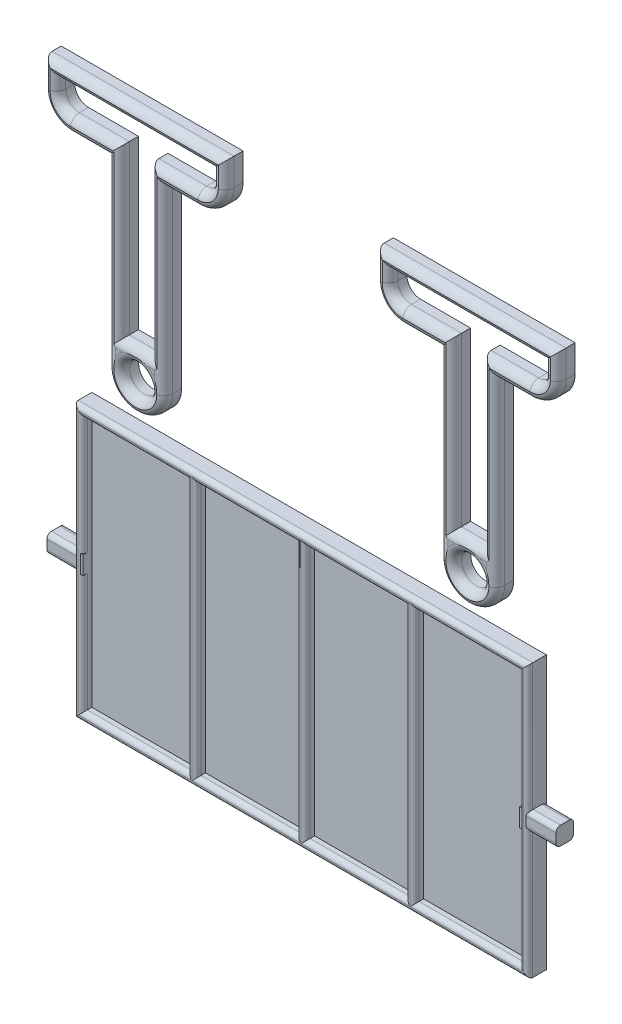
from build123d import *

# Parameters (mm, degrees)
CROQUIS1_W                   = 50
CROQUIS1_H                   = 30
SALIENTE_EXTRUIR1_DEPTH      = 1
CROQUIS2_W                   = 11.5
CROQUIS2_H                   = 28
CROQUIS2_W_2                 = 11
SALIENTE_EXTRUIR2_DEPTH      = 1
REDONDEO1_R                  = 0.5
SALIENTE_EXTRUIR3_DEPTH      = 0.95
SALIENTE_EXTRUIR3_DEPTH_BACK = 1
CROQUIS3_W                   = 4
CROQUIS3_H                   = 2
REDONDEO3_R                  = 0.5
CROQUIS4_R                   = 1.6
SALIENTE_EXTRUIR6_DEPTH      = 2
SALIENTE_EXTRUIR6_2_DEPTH    = 2
REDONDEO4_R                  = 1
REDONDEO5_R                  = 1


# Some blends are built 0.0001 mm under size
with BuildPart() as part:
    # Croquis1 → Saliente-Extruir1 (new body)
    with BuildSketch(Plane.XY):
        Rectangle(CROQUIS1_W, CROQUIS1_H)
    extrude(amount=SALIENTE_EXTRUIR1_DEPTH)

    # Croquis2 → Saliente-Extruir2 (add)
    with BuildSketch(Plane.XY.offset(1)):
        Polygon((-25, 15), (-24, 15), (24, 15), (25, 15), (25, -14), (25, -15), (-24, -15), (-25, -15), align=None)
        with Locations((-18.25, 0)):
            Rectangle(CROQUIS2_W, CROQUIS2_H, mode=Mode.SUBTRACT)
        with Locations((-6, 0)):
            Rectangle(CROQUIS2_W_2, CROQUIS2_H, mode=Mode.SUBTRACT)
        with Locations((18.25, 0)):
            Rectangle(CROQUIS2_W, CROQUIS2_H, mode=Mode.SUBTRACT)
        with Locations((6, 0)):
            Rectangle(CROQUIS2_W_2, CROQUIS2_H, mode=Mode.SUBTRACT)
    extrude(amount=SALIENTE_EXTRUIR2_DEPTH)

    # Redondeo1
    redondeo1_edges = [part.edges().sort_by_distance(p)[0] for p in [
        (-25, 0, 2),
        (0, -15, 2),
        (25, 0, 2),
        (0, 15, 2),
        (-18.25, -14, 2),
        (-12.5, 0, 2),
        (-18.25, 14, 2),
        (-24, 0, 2),
        (18.25, -14, 2),
        (24, 0, 2),
        (18.25, 14, 2),
        (12.5, 0, 2),
        (6, -14, 2),
        (11.5, 0, 2),
        (6, 14, 2),
        (0.5, 0, 2),
        (-6, -14, 2),
        (-0.5, 0, 2),
        (-6, 14, 2),
        (-11.5, 0, 2),
    ]]
    fillet(redondeo1_edges, radius=REDONDEO1_R - 0.0001)  # a hair under: the kernel refuses the full size

    # Croquis3 → Saliente-Extruir3 (add, two sides: drawn at the far end of the back side and taken through both)
    with BuildSketch(Plane.XY.offset(1).offset(-SALIENTE_EXTRUIR3_DEPTH_BACK)):
        with Locations((-26, 0)):
            Rectangle(CROQUIS3_W, CROQUIS3_H)
        with Locations((26, 0)):
            Rectangle(CROQUIS3_W, CROQUIS3_H)
    extrude(amount=SALIENTE_EXTRUIR3_DEPTH + SALIENTE_EXTRUIR3_DEPTH_BACK)

    # Redondeo3
    redondeo3_edges = [part.edges().sort_by_distance(p)[0] for p in [
        (-26.5, -1, 0),
        (-26.5, 1, 0),
        (-26.359011002, -1, 1.95),
        (-26.359011002, 1, 1.95),
        (26.5, -1, 0),
        (26.5, 1, 0),
        (26.359011002, -1, 1.95),
        (26.359011002, 1, 1.95),
    ]]
    fillet(redondeo3_edges, radius=REDONDEO3_R)


with BuildPart() as body_2:
    # Croquis4 → Saliente-Extruir6 (new body)
    with BuildSketch(Plane.XY):
        with BuildLine():
            Line((15.163338431, 40.314929212), (11.163338431, 40.314929212))
            ThreePointArc((11.163338431, 40.314929212), (9.042018087, 41.193608868), (8.163338431, 43.314929212))
            Line((8.163338431, 43.314929212), (8.163338431, 46.314929212))
            Line((8.163338431, 46.314929212), (28.163338431, 46.314929212))
            Line((28.163338431, 46.314929212), (28.163338431, 43.314929212))
            ThreePointArc((28.163338431, 43.314929212), (27.284658775, 41.193608868), (25.163338431, 40.314929212))
            Line((25.163338431, 40.314929212), (21.410533823, 40.314929212))
            Line((21.410533823, 40.314929212), (21.410533823, 20.314929212))
            ThreePointArc((21.410533823, 20.314929212), (18.286936127, 17.191331515), (15.163338431, 20.314929212))
            Line((15.163338431, 20.314929212), (15.163338431, 40.314929212))
        make_face()
        with Locations((18.286936127, 20.314929212)):
            Circle(CROQUIS4_R, mode=Mode.SUBTRACT)
        with BuildLine():
            Line((16.663338431, 41.965138463), (11.163338431, 41.965138463))
            ThreePointArc((11.163338431, 41.965138463), (10.102678259, 42.404478291), (9.663338431, 43.465138463))
            Line((9.663338431, 43.465138463), (9.663338431, 44.814929212))
            Line((9.663338431, 44.814929212), (26.663338431, 44.814929212))
            Line((26.663338431, 44.814929212), (26.663338431, 43.465138463))
            ThreePointArc((26.663338431, 43.465138463), (26.223998603, 42.404478291), (25.163338431, 41.965138463))
            Line((25.163338431, 41.965138463), (19.910533823, 41.965138463))
            Line((19.910533823, 41.965138463), (19.910533823, 23.544908309))
            Line((19.910533823, 23.544908309), (16.663338431, 23.544908309))
            Line((16.663338431, 23.544908309), (16.663338431, 41.965138463))
        make_face(mode=Mode.SUBTRACT)
    extrude(amount=SALIENTE_EXTRUIR6_DEPTH)

    # Redondeo4
    # the kernel refuses this fillet: 1 mm, written as the material it takes off along each edge
    with BuildSketch(Plane(origin=(25.163338431, 40.314929212, 2), x_dir=(0, 0, -1), z_dir=(-1, 0, 0))) as redondeo4_piece_1:
        with BuildLine():
            CenterArc((REDONDEO4_R, -REDONDEO4_R), REDONDEO4_R, 90, 90)
            Line((0, -REDONDEO4_R), (0, 0))
            Line((0, 0), (REDONDEO4_R, 0))
        make_face()
    extrude(amount=3.752804608, mode=Mode.SUBTRACT)
    with BuildSketch(Plane(origin=(25.163338431, 43.314929212, 2), x_dir=(1, 0, 0), z_dir=(0, 1, 0))) as redondeo4_piece_2:
        with BuildLine():
            CenterArc((3 - REDONDEO4_R, REDONDEO4_R), REDONDEO4_R, 270, 90)
            Line((3 - REDONDEO4_R, 0), (3, 0))
            Line((3, 0), (3, REDONDEO4_R))
        make_face()
    revolve(axis=Axis((25.163338431, 43.314929212, 2), (0, 0, -1)), revolution_arc=90, mode=Mode.SUBTRACT)
    with BuildSketch(Plane(origin=(28.163338431, 48.814929212, 2), x_dir=(0, 0, -1), z_dir=(0, -1, 0)), Plane(origin=(8.163338431, 43.314929212, 2), x_dir=(0, 0, -1), z_dir=(0, 1, 0))) as redondeo4_piece_3:
        with BuildLine():
            CenterArc((REDONDEO4_R, -REDONDEO4_R), REDONDEO4_R, 90, 90)
            Line((0, -REDONDEO4_R), (0, 0))
            Line((0, 0), (REDONDEO4_R, 0))
        make_face()
    extrude(amount=5.5, mode=Mode.SUBTRACT)
    with BuildSketch(Plane(origin=(5.663338431, 46.314929212, 2), x_dir=(0, 0, -1), z_dir=(1, 0, 0))) as redondeo4_piece_4:
        with BuildLine():
            CenterArc((REDONDEO4_R, -REDONDEO4_R), REDONDEO4_R, 90, 90)
            Line((0, -REDONDEO4_R), (0, 0))
            Line((0, 0), (REDONDEO4_R, 0))
        make_face()
    extrude(amount=25, mode=Mode.SUBTRACT)
    with BuildSketch(Plane(origin=(11.163338431, 43.314929212, 2), x_dir=(0, -1, 0), z_dir=(1, 0, 0))) as redondeo4_piece_5:
        with BuildLine():
            CenterArc((3 - REDONDEO4_R, REDONDEO4_R), REDONDEO4_R, 270, 90)
            Line((3 - REDONDEO4_R, 0), (3, 0))
            Line((3, 0), (3, REDONDEO4_R))
        make_face()
    revolve(axis=Axis((11.163338431, 43.314929212, 2), (0, 0, -1)), revolution_arc=90, mode=Mode.SUBTRACT)
    with BuildSketch(Plane(origin=(15.163338431, 40.314929212, 2), x_dir=(0, 0, -1), z_dir=(-1, 0, 0))) as redondeo4_piece_6:
        with BuildLine():
            CenterArc((REDONDEO4_R, -REDONDEO4_R), REDONDEO4_R, 90, 90)
            Line((0, -REDONDEO4_R), (0, 0))
            Line((0, 0), (REDONDEO4_R, 0))
        make_face()
    extrude(amount=4, mode=Mode.SUBTRACT)
    with BuildSketch(Plane(origin=(15.163338431, 20.314929212, 2), x_dir=(0, 0, -1), z_dir=(0, 1, 0)), Plane(origin=(21.410533823, 40.314929212, 2), x_dir=(0, 0, -1), z_dir=(0, -1, 0))) as redondeo4_piece_7:
        with BuildLine():
            CenterArc((REDONDEO4_R, -REDONDEO4_R), REDONDEO4_R, 90, 90)
            Line((0, -REDONDEO4_R), (0, 0))
            Line((0, 0), (REDONDEO4_R, 0))
        make_face()
    extrude(amount=20, mode=Mode.SUBTRACT)
    with BuildSketch(Plane(origin=(19.910533823, 23.544908309, 2), x_dir=(0, 0, -1), z_dir=(-1, 0, 0))) as redondeo4_piece_8:
        with BuildLine():
            CenterArc((REDONDEO4_R, REDONDEO4_R), REDONDEO4_R, 180, 90)
            Line((0, REDONDEO4_R), (0, 0))
            Line((0, 0), (REDONDEO4_R, 0))
        make_face()
    extrude(amount=3.247195392, mode=Mode.SUBTRACT)
    with BuildSketch(Plane(origin=(25.163338431, 41.965138463, 2), x_dir=(0, 0, -1), z_dir=(-1, 0, 0))) as redondeo4_piece_9:
        with BuildLine():
            CenterArc((REDONDEO4_R, REDONDEO4_R), REDONDEO4_R, 180, 90)
            Line((0, REDONDEO4_R), (0, 0))
            Line((0, 0), (REDONDEO4_R, 0))
        make_face()
    extrude(amount=7.752804608, mode=Mode.SUBTRACT)
    with BuildSketch(Plane(origin=(25.163338431, 43.465138463, 2), x_dir=(1, 0, 0), z_dir=(0, 1, 0))) as redondeo4_piece_10:
        with BuildLine():
            CenterArc((1.5 + REDONDEO4_R, REDONDEO4_R), REDONDEO4_R, 180, 90)
            Line((1.5 + REDONDEO4_R, 0), (1.5, 0))
            Line((1.5, 0), (1.5, REDONDEO4_R))
        make_face()
    revolve(axis=Axis((25.163338431, 43.465138463, 2), (0, 0, -1)), revolution_arc=90, mode=Mode.SUBTRACT)
    with BuildSketch(Plane(origin=(26.663338431, 44.814929212, 2), x_dir=(0, 0, -1), z_dir=(0, -1, 0)), Plane(origin=(9.663338431, 43.465138463, 2), x_dir=(0, 0, -1), z_dir=(0, 1, 0))) as redondeo4_piece_11:
        with BuildLine():
            CenterArc((REDONDEO4_R, REDONDEO4_R), REDONDEO4_R, 180, 90)
            Line((0, REDONDEO4_R), (0, 0))
            Line((0, 0), (REDONDEO4_R, 0))
        make_face()
    extrude(amount=1.349790749, mode=Mode.SUBTRACT)
    with BuildSketch(Plane(origin=(11.163338431, 43.465138463, 2), x_dir=(0, -1, 0), z_dir=(1, 0, 0))) as redondeo4_piece_12:
        with BuildLine():
            CenterArc((1.5 + REDONDEO4_R, REDONDEO4_R), REDONDEO4_R, 180, 90)
            Line((1.5 + REDONDEO4_R, 0), (1.5, 0))
            Line((1.5, 0), (1.5, REDONDEO4_R))
        make_face()
    revolve(axis=Axis((11.163338431, 43.465138463, 2), (0, 0, -1)), revolution_arc=90, mode=Mode.SUBTRACT)
    with BuildSketch(Plane(origin=(19.163338431, 41.965138463, 2), x_dir=(0, 0, -1), z_dir=(-1, 0, 0))) as redondeo4_piece_13:
        with BuildLine():
            CenterArc((REDONDEO4_R, REDONDEO4_R), REDONDEO4_R, 180, 90)
            Line((0, REDONDEO4_R), (0, 0))
            Line((0, 0), (REDONDEO4_R, 0))
        make_face()
    extrude(amount=8, mode=Mode.SUBTRACT)
    with BuildSketch(Plane(origin=(16.663338431, 23.544908309, 2), x_dir=(0, 0, -1), z_dir=(0, 1, 0)), Plane(origin=(19.910533823, 44.465138463, 2), x_dir=(0, 0, -1), z_dir=(0, -1, 0))) as redondeo4_piece_14:
        with BuildLine():
            CenterArc((REDONDEO4_R, REDONDEO4_R), REDONDEO4_R, 180, 90)
            Line((0, REDONDEO4_R), (0, 0))
            Line((0, 0), (REDONDEO4_R, 0))
        make_face()
    extrude(amount=20.920230154, mode=Mode.SUBTRACT)
    with BuildSketch(Plane(origin=(9.663338431, 44.814929212, 2), x_dir=(0, 0, -1), z_dir=(1, 0, 0))) as redondeo4_piece_15:
        with BuildLine():
            CenterArc((REDONDEO4_R, REDONDEO4_R), REDONDEO4_R, 180, 90)
            Line((0, REDONDEO4_R), (0, 0))
            Line((0, 0), (REDONDEO4_R, 0))
        make_face()
    extrude(amount=17, mode=Mode.SUBTRACT)
    with BuildSketch(Plane(origin=(18.286936127, 20.314929212, 2), x_dir=(1, 0, 0), z_dir=(0, 1, 0))) as redondeo4_piece_16:
        with BuildLine():
            CenterArc((3.123597696 - REDONDEO4_R, REDONDEO4_R), REDONDEO4_R, 270, 90)
            Line((3.123597696 - REDONDEO4_R, 0), (3.123597696, 0))
            Line((3.123597696, 0), (3.123597696, REDONDEO4_R))
        make_face()
    revolve(axis=Axis((18.286936127, 20.314929212, 2), (0, 0, -1)), revolution_arc=180, mode=Mode.SUBTRACT)
    with BuildSketch(Plane(origin=(18.286936127, 20.314929212, 2), x_dir=(1, 0, 0), z_dir=(0, -1, 0))) as redondeo4_piece_17:
        with BuildLine():
            CenterArc((1.6 + REDONDEO4_R, -REDONDEO4_R), REDONDEO4_R, 90, 90)
            Line((1.6 + REDONDEO4_R, 0), (1.6, 0))
            Line((1.6, 0), (1.6, -REDONDEO4_R))
        make_face()
    revolve(axis=Axis((18.286936127, 20.314929212, 2), (0, 0, 1)), mode=Mode.SUBTRACT)
    with BuildSketch(Plane(origin=(25.163338431, 40.314929212, 2), x_dir=(0, 0, -1), z_dir=(-1, 0, 0))) as redondeo4_piece_18a_section:
        with BuildLine():
            CenterArc((REDONDEO4_R, -REDONDEO4_R), REDONDEO4_R, 90, 90)
            Line((0, -REDONDEO4_R), (0, 0))
            Line((0, 0), (REDONDEO4_R, 0))
        make_face()
    redondeo4_piece_18a = extrude(amount=6.252804608, mode=Mode.PRIVATE)
    redondeo4_piece_18a = split(redondeo4_piece_18a, bisect_by=Plane(origin=(21.410533823, 40.541324326, 1.773604886), z_dir=(-1, 0, 0)), keep=Keep.TOP, mode=Mode.PRIVATE)
    with BuildSketch(Plane(origin=(21.410533823, 42.814929212, 2), x_dir=(0, 0, -1), z_dir=(0, -1, 0))) as redondeo4_piece_18b_section:
        with BuildLine():
            CenterArc((REDONDEO4_R, -REDONDEO4_R), REDONDEO4_R, 90, 90)
            Line((0, -REDONDEO4_R), (0, 0))
            Line((0, 0), (REDONDEO4_R, 0))
        make_face()
    redondeo4_piece_18b = extrude(amount=22.5, mode=Mode.PRIVATE)
    redondeo4_piece_18b = split(redondeo4_piece_18b, bisect_by=Plane(origin=(21.184138709, 40.314929212, 1.773604886), z_dir=(0, 1, 0)), keep=Keep.TOP, mode=Mode.PRIVATE)
    redondeo4_piece_18 = redondeo4_piece_18a & redondeo4_piece_18b
    add(redondeo4_piece_18, mode=Mode.SUBTRACT)
    with BuildSketch(Plane(origin=(15.163338431, 20.314929212, 2), x_dir=(0, 0, -1), z_dir=(0, 1, 0))) as redondeo4_piece_19a_section:
        with BuildLine():
            CenterArc((REDONDEO4_R, -REDONDEO4_R), REDONDEO4_R, 90, 90)
            Line((0, -REDONDEO4_R), (0, 0))
            Line((0, 0), (REDONDEO4_R, 0))
        make_face()
    redondeo4_piece_19a = extrude(amount=22.5, mode=Mode.PRIVATE)
    redondeo4_piece_19a = split(redondeo4_piece_19a, bisect_by=Plane(origin=(15.389733545, 40.314929212, 1.773604886), z_dir=(0, 1, 0)), keep=Keep.TOP, mode=Mode.PRIVATE)
    with BuildSketch(Plane(origin=(17.663338431, 40.314929212, 2), x_dir=(0, 0, -1), z_dir=(-1, 0, 0))) as redondeo4_piece_19b_section:
        with BuildLine():
            CenterArc((REDONDEO4_R, -REDONDEO4_R), REDONDEO4_R, 90, 90)
            Line((0, -REDONDEO4_R), (0, 0))
            Line((0, 0), (REDONDEO4_R, 0))
        make_face()
    redondeo4_piece_19b = extrude(amount=6.5, mode=Mode.PRIVATE)
    redondeo4_piece_19b = split(redondeo4_piece_19b, bisect_by=Plane(origin=(15.163338431, 40.541324326, 1.773604886), z_dir=(1, 0, 0)), keep=Keep.TOP, mode=Mode.PRIVATE)
    redondeo4_piece_19 = redondeo4_piece_19a & redondeo4_piece_19b
    add(redondeo4_piece_19, mode=Mode.SUBTRACT)
    with BuildSketch(Plane(origin=(22.410533823, 23.544908309, 2), x_dir=(0, 0, -1), z_dir=(-1, 0, 0))) as redondeo4_piece_20a_section:
        with BuildLine():
            CenterArc((REDONDEO4_R, REDONDEO4_R), REDONDEO4_R, 180, 90)
            Line((0, REDONDEO4_R), (0, 0))
            Line((0, 0), (REDONDEO4_R, 0))
        make_face()
    redondeo4_piece_20a = extrude(amount=5.747195392, mode=Mode.PRIVATE)
    redondeo4_piece_20a = split(redondeo4_piece_20a, bisect_by=Plane(origin=(19.910533823, 23.318513195, 1.773604886), z_dir=(1, 0, 0)), keep=Keep.TOP, mode=Mode.PRIVATE)
    with BuildSketch(Plane(origin=(19.910533823, 44.465138463, 2), x_dir=(0, 0, -1), z_dir=(0, -1, 0))) as redondeo4_piece_20b_section:
        with BuildLine():
            CenterArc((REDONDEO4_R, REDONDEO4_R), REDONDEO4_R, 180, 90)
            Line((0, REDONDEO4_R), (0, 0))
            Line((0, 0), (REDONDEO4_R, 0))
        make_face()
    redondeo4_piece_20b = extrude(amount=23.420230154, mode=Mode.PRIVATE)
    redondeo4_piece_20b = split(redondeo4_piece_20b, bisect_by=Plane(origin=(20.136928938, 23.544908309, 1.773604886), z_dir=(0, -1, 0)), keep=Keep.TOP, mode=Mode.PRIVATE)
    redondeo4_piece_20 = redondeo4_piece_20a & redondeo4_piece_20b
    add(redondeo4_piece_20, mode=Mode.SUBTRACT)
    with BuildSketch(Plane(origin=(16.663338431, 21.044908309, 2), x_dir=(0, 0, -1), z_dir=(0, 1, 0))) as redondeo4_piece_21a_section:
        with BuildLine():
            CenterArc((REDONDEO4_R, REDONDEO4_R), REDONDEO4_R, 180, 90)
            Line((0, REDONDEO4_R), (0, 0))
            Line((0, 0), (REDONDEO4_R, 0))
        make_face()
    redondeo4_piece_21a = extrude(amount=23.420230154, mode=Mode.PRIVATE)
    redondeo4_piece_21a = split(redondeo4_piece_21a, bisect_by=Plane(origin=(16.436943317, 23.544908309, 1.773604886), z_dir=(0, -1, 0)), keep=Keep.TOP, mode=Mode.PRIVATE)
    with BuildSketch(Plane(origin=(19.910533823, 23.544908309, 2), x_dir=(0, 0, -1), z_dir=(-1, 0, 0))) as redondeo4_piece_21b_section:
        with BuildLine():
            CenterArc((REDONDEO4_R, REDONDEO4_R), REDONDEO4_R, 180, 90)
            Line((0, REDONDEO4_R), (0, 0))
            Line((0, 0), (REDONDEO4_R, 0))
        make_face()
    redondeo4_piece_21b = extrude(amount=5.747195392, mode=Mode.PRIVATE)
    redondeo4_piece_21b = split(redondeo4_piece_21b, bisect_by=Plane(origin=(16.663338431, 23.318513195, 1.773604886), z_dir=(-1, 0, 0)), keep=Keep.TOP, mode=Mode.PRIVATE)
    redondeo4_piece_21 = redondeo4_piece_21a & redondeo4_piece_21b
    add(redondeo4_piece_21, mode=Mode.SUBTRACT)
    with BuildSketch(Plane(origin=(26.663338431, 47.314929212, 2), x_dir=(0, 0, -1), z_dir=(0, -1, 0))) as redondeo4_piece_22a_section:
        with BuildLine():
            CenterArc((REDONDEO4_R, REDONDEO4_R), REDONDEO4_R, 180, 90)
            Line((0, REDONDEO4_R), (0, 0))
            Line((0, 0), (REDONDEO4_R, 0))
        make_face()
    redondeo4_piece_22a = extrude(amount=3.849790749, mode=Mode.PRIVATE)
    redondeo4_piece_22a = split(redondeo4_piece_22a, bisect_by=Plane(origin=(26.889733545, 44.814929212, 1.773604886), z_dir=(0, 1, 0)), keep=Keep.TOP, mode=Mode.PRIVATE)
    with BuildSketch(Plane(origin=(9.663338431, 44.814929212, 2), x_dir=(0, 0, -1), z_dir=(1, 0, 0))) as redondeo4_piece_22b_section:
        with BuildLine():
            CenterArc((REDONDEO4_R, REDONDEO4_R), REDONDEO4_R, 180, 90)
            Line((0, REDONDEO4_R), (0, 0))
            Line((0, 0), (REDONDEO4_R, 0))
        make_face()
    redondeo4_piece_22b = extrude(amount=19.5, mode=Mode.PRIVATE)
    redondeo4_piece_22b = split(redondeo4_piece_22b, bisect_by=Plane(origin=(26.663338431, 45.041324326, 1.773604886), z_dir=(1, 0, 0)), keep=Keep.TOP, mode=Mode.PRIVATE)
    redondeo4_piece_22 = redondeo4_piece_22a & redondeo4_piece_22b
    add(redondeo4_piece_22, mode=Mode.SUBTRACT)
    with BuildSketch(Plane(origin=(7.163338431, 44.814929212, 2), x_dir=(0, 0, -1), z_dir=(1, 0, 0))) as redondeo4_piece_23a_section:
        with BuildLine():
            CenterArc((REDONDEO4_R, REDONDEO4_R), REDONDEO4_R, 180, 90)
            Line((0, REDONDEO4_R), (0, 0))
            Line((0, 0), (REDONDEO4_R, 0))
        make_face()
    redondeo4_piece_23a = extrude(amount=19.5, mode=Mode.PRIVATE)
    redondeo4_piece_23a = split(redondeo4_piece_23a, bisect_by=Plane(origin=(9.663338431, 45.041324326, 1.773604886), z_dir=(-1, 0, 0)), keep=Keep.TOP, mode=Mode.PRIVATE)
    with BuildSketch(Plane(origin=(9.663338431, 43.465138463, 2), x_dir=(0, 0, -1), z_dir=(0, 1, 0))) as redondeo4_piece_23b_section:
        with BuildLine():
            CenterArc((REDONDEO4_R, REDONDEO4_R), REDONDEO4_R, 180, 90)
            Line((0, REDONDEO4_R), (0, 0))
            Line((0, 0), (REDONDEO4_R, 0))
        make_face()
    redondeo4_piece_23b = extrude(amount=3.849790749, mode=Mode.PRIVATE)
    redondeo4_piece_23b = split(redondeo4_piece_23b, bisect_by=Plane(origin=(9.436943317, 44.814929212, 1.773604886), z_dir=(0, 1, 0)), keep=Keep.TOP, mode=Mode.PRIVATE)
    redondeo4_piece_23 = redondeo4_piece_23a & redondeo4_piece_23b
    add(redondeo4_piece_23, mode=Mode.SUBTRACT)


with BuildPart() as body_3:
    # Croquis4 → Saliente-Extruir6 2 (new body)
    with BuildSketch(Plane.XY):
        with BuildLine():
            Line((-28.373597696, 43.314929212), (-28.373597696, 46.314929212))
            Line((-28.373597696, 46.314929212), (-8.373597696, 46.314929212))
            Line((-8.373597696, 46.314929212), (-8.373597696, 43.314929212))
            ThreePointArc((-8.373597696, 43.314929212), (-9.252277353, 41.193608868), (-11.373597696, 40.314929212))
            Line((-11.373597696, 40.314929212), (-15.126402304, 40.314929212))
            Line((-15.126402304, 40.314929212), (-15.126402304, 20.314929212))
            ThreePointArc((-15.126402304, 20.314929212), (-18.25, 17.191331515), (-21.373597696, 20.314929212))
            Line((-21.373597696, 20.314929212), (-21.373597696, 40.314929212))
            Line((-21.373597696, 40.314929212), (-25.373597696, 40.314929212))
            ThreePointArc((-25.373597696, 40.314929212), (-27.49491804, 41.193608868), (-28.373597696, 43.314929212))
        make_face()
        with Locations((-18.25, 20.314929212)):
            Circle(CROQUIS4_R, mode=Mode.SUBTRACT)
        with BuildLine():
            Line((-9.873597696, 44.814929212), (-9.873597696, 43.465138463))
            ThreePointArc((-9.873597696, 43.465138463), (-10.312937524, 42.404478291), (-11.373597696, 41.965138463))
            Line((-11.373597696, 41.965138463), (-16.626402304, 41.965138463))
            Line((-16.626402304, 41.965138463), (-16.626402304, 23.544908309))
            Line((-16.626402304, 23.544908309), (-19.873597696, 23.544908309))
            Line((-19.873597696, 23.544908309), (-19.873597696, 41.965138463))
            Line((-19.873597696, 41.965138463), (-25.373597696, 41.965138463))
            ThreePointArc((-25.373597696, 41.965138463), (-26.434257868, 42.404478291), (-26.873597696, 43.465138463))
            Line((-26.873597696, 43.465138463), (-26.873597696, 44.814929212))
            Line((-26.873597696, 44.814929212), (-9.873597696, 44.814929212))
        make_face(mode=Mode.SUBTRACT)
    extrude(amount=SALIENTE_EXTRUIR6_2_DEPTH)

    # Redondeo5
    # the kernel refuses this fillet: 1 mm, written as the material it takes off along each edge
    with BuildSketch(Plane(origin=(-16.626402304, 23.544908309, 2), x_dir=(0, 0, -1), z_dir=(-1, 0, 0))) as redondeo5_piece_1:
        with BuildLine():
            CenterArc((REDONDEO5_R, REDONDEO5_R), REDONDEO5_R, 180, 90)
            Line((0, REDONDEO5_R), (0, 0))
            Line((0, 0), (REDONDEO5_R, 0))
        make_face()
    extrude(amount=3.247195392, mode=Mode.SUBTRACT)
    with BuildSketch(Plane(origin=(-19.873597696, 23.544908309, 2), x_dir=(0, 0, -1), z_dir=(0, 1, 0)), Plane(origin=(-16.626402304, 44.465138463, 2), x_dir=(0, 0, -1), z_dir=(0, -1, 0))) as redondeo5_piece_2:
        with BuildLine():
            CenterArc((REDONDEO5_R, REDONDEO5_R), REDONDEO5_R, 180, 90)
            Line((0, REDONDEO5_R), (0, 0))
            Line((0, 0), (REDONDEO5_R, 0))
        make_face()
    extrude(amount=20.920230154, mode=Mode.SUBTRACT)
    with BuildSketch(Plane(origin=(-17.373597696, 41.965138463, 2), x_dir=(0, 0, -1), z_dir=(-1, 0, 0))) as redondeo5_piece_3:
        with BuildLine():
            CenterArc((REDONDEO5_R, REDONDEO5_R), REDONDEO5_R, 180, 90)
            Line((0, REDONDEO5_R), (0, 0))
            Line((0, 0), (REDONDEO5_R, 0))
        make_face()
    extrude(amount=8, mode=Mode.SUBTRACT)
    with BuildSketch(Plane(origin=(-25.373597696, 43.465138463, 2), x_dir=(0, -1, 0), z_dir=(1, 0, 0))) as redondeo5_piece_4:
        with BuildLine():
            CenterArc((1.5 + REDONDEO5_R, REDONDEO5_R), REDONDEO5_R, 180, 90)
            Line((1.5 + REDONDEO5_R, 0), (1.5, 0))
            Line((1.5, 0), (1.5, REDONDEO5_R))
        make_face()
    revolve(axis=Axis((-25.373597696, 43.465138463, 2), (0, 0, -1)), revolution_arc=90, mode=Mode.SUBTRACT)
    with BuildSketch(Plane(origin=(-26.873597696, 43.465138463, 2), x_dir=(0, 0, -1), z_dir=(0, 1, 0)), Plane(origin=(-9.873597696, 44.814929212, 2), x_dir=(0, 0, -1), z_dir=(0, -1, 0))) as redondeo5_piece_5:
        with BuildLine():
            CenterArc((REDONDEO5_R, REDONDEO5_R), REDONDEO5_R, 180, 90)
            Line((0, REDONDEO5_R), (0, 0))
            Line((0, 0), (REDONDEO5_R, 0))
        make_face()
    extrude(amount=1.349790749, mode=Mode.SUBTRACT)
    with BuildSketch(Plane(origin=(-26.873597696, 44.814929212, 2), x_dir=(0, 0, -1), z_dir=(1, 0, 0))) as redondeo5_piece_6:
        with BuildLine():
            CenterArc((REDONDEO5_R, REDONDEO5_R), REDONDEO5_R, 180, 90)
            Line((0, REDONDEO5_R), (0, 0))
            Line((0, 0), (REDONDEO5_R, 0))
        make_face()
    extrude(amount=17, mode=Mode.SUBTRACT)
    with BuildSketch(Plane(origin=(-11.373597696, 43.465138463, 2), x_dir=(1, 0, 0), z_dir=(0, 1, 0))) as redondeo5_piece_7:
        with BuildLine():
            CenterArc((1.5 + REDONDEO5_R, REDONDEO5_R), REDONDEO5_R, 180, 90)
            Line((1.5 + REDONDEO5_R, 0), (1.5, 0))
            Line((1.5, 0), (1.5, REDONDEO5_R))
        make_face()
    revolve(axis=Axis((-11.373597696, 43.465138463, 2), (0, 0, -1)), revolution_arc=90, mode=Mode.SUBTRACT)
    with BuildSketch(Plane(origin=(-11.373597696, 41.965138463, 2), x_dir=(0, 0, -1), z_dir=(-1, 0, 0))) as redondeo5_piece_8:
        with BuildLine():
            CenterArc((REDONDEO5_R, REDONDEO5_R), REDONDEO5_R, 180, 90)
            Line((0, REDONDEO5_R), (0, 0))
            Line((0, 0), (REDONDEO5_R, 0))
        make_face()
    extrude(amount=7.752804608, mode=Mode.SUBTRACT)
    with BuildSketch(Plane(origin=(-18.25, 20.314929212, 2), x_dir=(1, 0, 0), z_dir=(0, -1, 0))) as redondeo5_piece_9:
        with BuildLine():
            CenterArc((1.6 + REDONDEO5_R, -REDONDEO5_R), REDONDEO5_R, 90, 90)
            Line((1.6 + REDONDEO5_R, 0), (1.6, 0))
            Line((1.6, 0), (1.6, -REDONDEO5_R))
        make_face()
    revolve(axis=Axis((-18.25, 20.314929212, 2), (0, 0, 1)), mode=Mode.SUBTRACT)
    with BuildSketch(Plane(origin=(-18.25, 20.314929212, 2), x_dir=(1, 0, 0), z_dir=(0, 1, 0))) as redondeo5_piece_10:
        with BuildLine():
            CenterArc((3.123597696 - REDONDEO5_R, REDONDEO5_R), REDONDEO5_R, 270, 90)
            Line((3.123597696 - REDONDEO5_R, 0), (3.123597696, 0))
            Line((3.123597696, 0), (3.123597696, REDONDEO5_R))
        make_face()
    revolve(axis=Axis((-18.25, 20.314929212, 2), (0, 0, -1)), revolution_arc=180, mode=Mode.SUBTRACT)
    with BuildSketch(Plane(origin=(-15.126402304, 40.314929212, 2), x_dir=(0, 0, -1), z_dir=(0, -1, 0)), Plane(origin=(-21.373597696, 20.314929212, 2), x_dir=(0, 0, -1), z_dir=(0, 1, 0))) as redondeo5_piece_11:
        with BuildLine():
            CenterArc((REDONDEO5_R, -REDONDEO5_R), REDONDEO5_R, 90, 90)
            Line((0, -REDONDEO5_R), (0, 0))
            Line((0, 0), (REDONDEO5_R, 0))
        make_face()
    extrude(amount=20, mode=Mode.SUBTRACT)
    with BuildSketch(Plane(origin=(-11.373597696, 40.314929212, 2), x_dir=(0, 0, -1), z_dir=(-1, 0, 0))) as redondeo5_piece_12:
        with BuildLine():
            CenterArc((REDONDEO5_R, -REDONDEO5_R), REDONDEO5_R, 90, 90)
            Line((0, -REDONDEO5_R), (0, 0))
            Line((0, 0), (REDONDEO5_R, 0))
        make_face()
    extrude(amount=3.752804608, mode=Mode.SUBTRACT)
    with BuildSketch(Plane(origin=(-11.373597696, 43.314929212, 2), x_dir=(1, 0, 0), z_dir=(0, 1, 0))) as redondeo5_piece_13:
        with BuildLine():
            CenterArc((3 - REDONDEO5_R, REDONDEO5_R), REDONDEO5_R, 270, 90)
            Line((3 - REDONDEO5_R, 0), (3, 0))
            Line((3, 0), (3, REDONDEO5_R))
        make_face()
    revolve(axis=Axis((-11.373597696, 43.314929212, 2), (0, 0, -1)), revolution_arc=90, mode=Mode.SUBTRACT)
    with BuildSketch(Plane(origin=(-8.373597696, 48.814929212, 2), x_dir=(0, 0, -1), z_dir=(0, -1, 0)), Plane(origin=(-28.373597696, 43.314929212, 2), x_dir=(0, 0, -1), z_dir=(0, 1, 0))) as redondeo5_piece_14:
        with BuildLine():
            CenterArc((REDONDEO5_R, -REDONDEO5_R), REDONDEO5_R, 90, 90)
            Line((0, -REDONDEO5_R), (0, 0))
            Line((0, 0), (REDONDEO5_R, 0))
        make_face()
    extrude(amount=5.5, mode=Mode.SUBTRACT)
    with BuildSketch(Plane(origin=(-30.873597696, 46.314929212, 2), x_dir=(0, 0, -1), z_dir=(1, 0, 0))) as redondeo5_piece_15:
        with BuildLine():
            CenterArc((REDONDEO5_R, -REDONDEO5_R), REDONDEO5_R, 90, 90)
            Line((0, -REDONDEO5_R), (0, 0))
            Line((0, 0), (REDONDEO5_R, 0))
        make_face()
    extrude(amount=25, mode=Mode.SUBTRACT)
    with BuildSketch(Plane(origin=(-25.373597696, 43.314929212, 2), x_dir=(0, -1, 0), z_dir=(1, 0, 0))) as redondeo5_piece_16:
        with BuildLine():
            CenterArc((3 - REDONDEO5_R, REDONDEO5_R), REDONDEO5_R, 270, 90)
            Line((3 - REDONDEO5_R, 0), (3, 0))
            Line((3, 0), (3, REDONDEO5_R))
        make_face()
    revolve(axis=Axis((-25.373597696, 43.314929212, 2), (0, 0, -1)), revolution_arc=90, mode=Mode.SUBTRACT)
    with BuildSketch(Plane(origin=(-21.373597696, 40.314929212, 2), x_dir=(0, 0, -1), z_dir=(-1, 0, 0))) as redondeo5_piece_17:
        with BuildLine():
            CenterArc((REDONDEO5_R, -REDONDEO5_R), REDONDEO5_R, 90, 90)
            Line((0, -REDONDEO5_R), (0, 0))
            Line((0, 0), (REDONDEO5_R, 0))
        make_face()
    extrude(amount=4, mode=Mode.SUBTRACT)
    with BuildSketch(Plane(origin=(-14.126402304, 23.544908309, 2), x_dir=(0, 0, -1), z_dir=(-1, 0, 0))) as redondeo5_piece_18a_section:
        with BuildLine():
            CenterArc((REDONDEO5_R, REDONDEO5_R), REDONDEO5_R, 180, 90)
            Line((0, REDONDEO5_R), (0, 0))
            Line((0, 0), (REDONDEO5_R, 0))
        make_face()
    redondeo5_piece_18a = extrude(amount=5.747195392, mode=Mode.PRIVATE)
    redondeo5_piece_18a = split(redondeo5_piece_18a, bisect_by=Plane(origin=(-16.626402304, 23.318513195, 1.773604886), z_dir=(1, 0, 0)), keep=Keep.TOP, mode=Mode.PRIVATE)
    with BuildSketch(Plane(origin=(-16.626402304, 44.465138463, 2), x_dir=(0, 0, -1), z_dir=(0, -1, 0))) as redondeo5_piece_18b_section:
        with BuildLine():
            CenterArc((REDONDEO5_R, REDONDEO5_R), REDONDEO5_R, 180, 90)
            Line((0, REDONDEO5_R), (0, 0))
            Line((0, 0), (REDONDEO5_R, 0))
        make_face()
    redondeo5_piece_18b = extrude(amount=23.420230154, mode=Mode.PRIVATE)
    redondeo5_piece_18b = split(redondeo5_piece_18b, bisect_by=Plane(origin=(-16.40000719, 23.544908309, 1.773604886), z_dir=(0, -1, 0)), keep=Keep.TOP, mode=Mode.PRIVATE)
    redondeo5_piece_18 = redondeo5_piece_18a & redondeo5_piece_18b
    add(redondeo5_piece_18, mode=Mode.SUBTRACT)
    with BuildSketch(Plane(origin=(-19.873597696, 21.044908309, 2), x_dir=(0, 0, -1), z_dir=(0, 1, 0))) as redondeo5_piece_19a_section:
        with BuildLine():
            CenterArc((REDONDEO5_R, REDONDEO5_R), REDONDEO5_R, 180, 90)
            Line((0, REDONDEO5_R), (0, 0))
            Line((0, 0), (REDONDEO5_R, 0))
        make_face()
    redondeo5_piece_19a = extrude(amount=23.420230154, mode=Mode.PRIVATE)
    redondeo5_piece_19a = split(redondeo5_piece_19a, bisect_by=Plane(origin=(-20.09999281, 23.544908309, 1.773604886), z_dir=(0, -1, 0)), keep=Keep.TOP, mode=Mode.PRIVATE)
    with BuildSketch(Plane(origin=(-16.626402304, 23.544908309, 2), x_dir=(0, 0, -1), z_dir=(-1, 0, 0))) as redondeo5_piece_19b_section:
        with BuildLine():
            CenterArc((REDONDEO5_R, REDONDEO5_R), REDONDEO5_R, 180, 90)
            Line((0, REDONDEO5_R), (0, 0))
            Line((0, 0), (REDONDEO5_R, 0))
        make_face()
    redondeo5_piece_19b = extrude(amount=5.747195392, mode=Mode.PRIVATE)
    redondeo5_piece_19b = split(redondeo5_piece_19b, bisect_by=Plane(origin=(-19.873597696, 23.318513195, 1.773604886), z_dir=(-1, 0, 0)), keep=Keep.TOP, mode=Mode.PRIVATE)
    redondeo5_piece_19 = redondeo5_piece_19a & redondeo5_piece_19b
    add(redondeo5_piece_19, mode=Mode.SUBTRACT)
    with BuildSketch(Plane(origin=(-29.373597696, 44.814929212, 2), x_dir=(0, 0, -1), z_dir=(1, 0, 0))) as redondeo5_piece_20a_section:
        with BuildLine():
            CenterArc((REDONDEO5_R, REDONDEO5_R), REDONDEO5_R, 180, 90)
            Line((0, REDONDEO5_R), (0, 0))
            Line((0, 0), (REDONDEO5_R, 0))
        make_face()
    redondeo5_piece_20a = extrude(amount=19.5, mode=Mode.PRIVATE)
    redondeo5_piece_20a = split(redondeo5_piece_20a, bisect_by=Plane(origin=(-26.873597696, 45.041324326, 1.773604886), z_dir=(-1, 0, 0)), keep=Keep.TOP, mode=Mode.PRIVATE)
    with BuildSketch(Plane(origin=(-26.873597696, 43.465138463, 2), x_dir=(0, 0, -1), z_dir=(0, 1, 0))) as redondeo5_piece_20b_section:
        with BuildLine():
            CenterArc((REDONDEO5_R, REDONDEO5_R), REDONDEO5_R, 180, 90)
            Line((0, REDONDEO5_R), (0, 0))
            Line((0, 0), (REDONDEO5_R, 0))
        make_face()
    redondeo5_piece_20b = extrude(amount=3.849790749, mode=Mode.PRIVATE)
    redondeo5_piece_20b = split(redondeo5_piece_20b, bisect_by=Plane(origin=(-27.09999281, 44.814929212, 1.773604886), z_dir=(0, 1, 0)), keep=Keep.TOP, mode=Mode.PRIVATE)
    redondeo5_piece_20 = redondeo5_piece_20a & redondeo5_piece_20b
    add(redondeo5_piece_20, mode=Mode.SUBTRACT)
    with BuildSketch(Plane(origin=(-26.873597696, 44.814929212, 2), x_dir=(0, 0, -1), z_dir=(1, 0, 0))) as redondeo5_piece_21a_section:
        with BuildLine():
            CenterArc((REDONDEO5_R, REDONDEO5_R), REDONDEO5_R, 180, 90)
            Line((0, REDONDEO5_R), (0, 0))
            Line((0, 0), (REDONDEO5_R, 0))
        make_face()
    redondeo5_piece_21a = extrude(amount=19.5, mode=Mode.PRIVATE)
    redondeo5_piece_21a = split(redondeo5_piece_21a, bisect_by=Plane(origin=(-9.873597696, 45.041324326, 1.773604886), z_dir=(1, 0, 0)), keep=Keep.TOP, mode=Mode.PRIVATE)
    with BuildSketch(Plane(origin=(-9.873597696, 47.314929212, 2), x_dir=(0, 0, -1), z_dir=(0, -1, 0))) as redondeo5_piece_21b_section:
        with BuildLine():
            CenterArc((REDONDEO5_R, REDONDEO5_R), REDONDEO5_R, 180, 90)
            Line((0, REDONDEO5_R), (0, 0))
            Line((0, 0), (REDONDEO5_R, 0))
        make_face()
    redondeo5_piece_21b = extrude(amount=3.849790749, mode=Mode.PRIVATE)
    redondeo5_piece_21b = split(redondeo5_piece_21b, bisect_by=Plane(origin=(-9.647202582, 44.814929212, 1.773604886), z_dir=(0, 1, 0)), keep=Keep.TOP, mode=Mode.PRIVATE)
    redondeo5_piece_21 = redondeo5_piece_21a & redondeo5_piece_21b
    add(redondeo5_piece_21, mode=Mode.SUBTRACT)
    with BuildSketch(Plane(origin=(-11.373597696, 40.314929212, 2), x_dir=(0, 0, -1), z_dir=(-1, 0, 0))) as redondeo5_piece_22a_section:
        with BuildLine():
            CenterArc((REDONDEO5_R, -REDONDEO5_R), REDONDEO5_R, 90, 90)
            Line((0, -REDONDEO5_R), (0, 0))
            Line((0, 0), (REDONDEO5_R, 0))
        make_face()
    redondeo5_piece_22a = extrude(amount=6.252804608, mode=Mode.PRIVATE)
    redondeo5_piece_22a = split(redondeo5_piece_22a, bisect_by=Plane(origin=(-15.126402304, 40.541324326, 1.773604886), z_dir=(-1, 0, 0)), keep=Keep.TOP, mode=Mode.PRIVATE)
    with BuildSketch(Plane(origin=(-15.126402304, 42.814929212, 2), x_dir=(0, 0, -1), z_dir=(0, -1, 0))) as redondeo5_piece_22b_section:
        with BuildLine():
            CenterArc((REDONDEO5_R, -REDONDEO5_R), REDONDEO5_R, 90, 90)
            Line((0, -REDONDEO5_R), (0, 0))
            Line((0, 0), (REDONDEO5_R, 0))
        make_face()
    redondeo5_piece_22b = extrude(amount=22.5, mode=Mode.PRIVATE)
    redondeo5_piece_22b = split(redondeo5_piece_22b, bisect_by=Plane(origin=(-15.352797418, 40.314929212, 1.773604886), z_dir=(0, 1, 0)), keep=Keep.TOP, mode=Mode.PRIVATE)
    redondeo5_piece_22 = redondeo5_piece_22a & redondeo5_piece_22b
    add(redondeo5_piece_22, mode=Mode.SUBTRACT)
    with BuildSketch(Plane(origin=(-21.373597696, 20.314929212, 2), x_dir=(0, 0, -1), z_dir=(0, 1, 0))) as redondeo5_piece_23a_section:
        with BuildLine():
            CenterArc((REDONDEO5_R, -REDONDEO5_R), REDONDEO5_R, 90, 90)
            Line((0, -REDONDEO5_R), (0, 0))
            Line((0, 0), (REDONDEO5_R, 0))
        make_face()
    redondeo5_piece_23a = extrude(amount=22.5, mode=Mode.PRIVATE)
    redondeo5_piece_23a = split(redondeo5_piece_23a, bisect_by=Plane(origin=(-21.147202582, 40.314929212, 1.773604886), z_dir=(0, 1, 0)), keep=Keep.TOP, mode=Mode.PRIVATE)
    with BuildSketch(Plane(origin=(-18.873597696, 40.314929212, 2), x_dir=(0, 0, -1), z_dir=(-1, 0, 0))) as redondeo5_piece_23b_section:
        with BuildLine():
            CenterArc((REDONDEO5_R, -REDONDEO5_R), REDONDEO5_R, 90, 90)
            Line((0, -REDONDEO5_R), (0, 0))
            Line((0, 0), (REDONDEO5_R, 0))
        make_face()
    redondeo5_piece_23b = extrude(amount=6.5, mode=Mode.PRIVATE)
    redondeo5_piece_23b = split(redondeo5_piece_23b, bisect_by=Plane(origin=(-21.373597696, 40.541324326, 1.773604886), z_dir=(1, 0, 0)), keep=Keep.TOP, mode=Mode.PRIVATE)
    redondeo5_piece_23 = redondeo5_piece_23a & redondeo5_piece_23b
    add(redondeo5_piece_23, mode=Mode.SUBTRACT)


solid = Compound([part.part, body_2.part, body_3.part])
